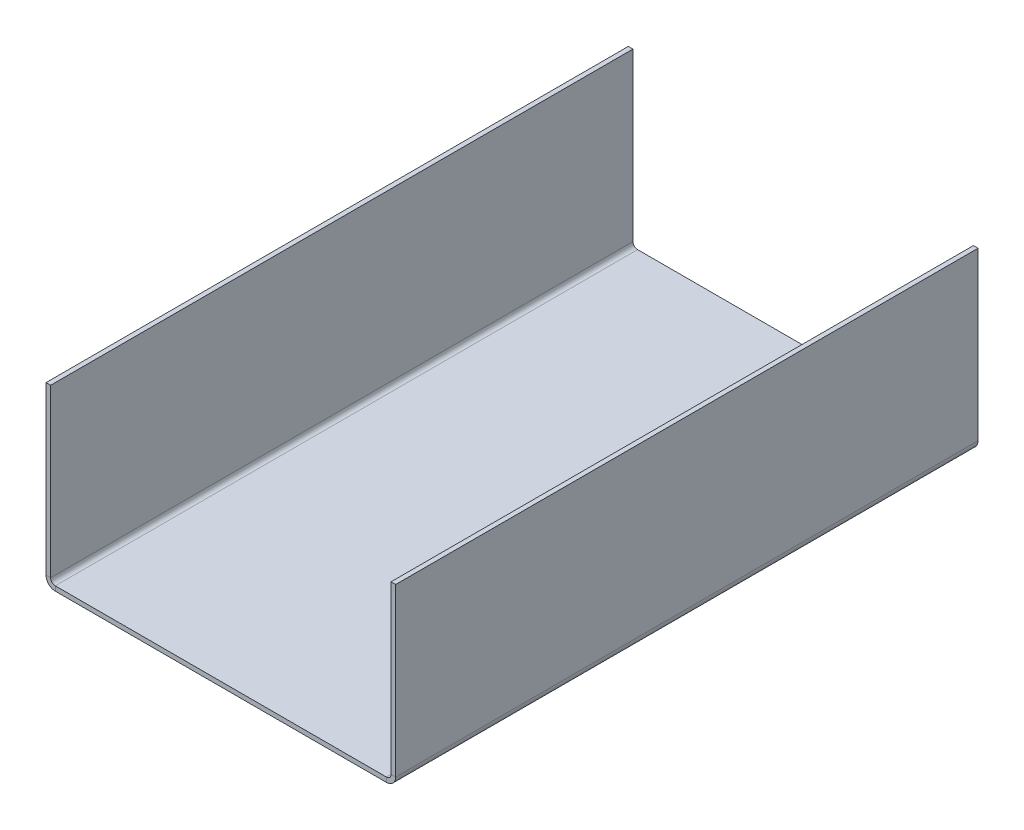
from build123d import *

# Parameters (mm, degrees)
SKETCH_2_W                       = 73.493597356
SKETCH_2_H                       = 125.730953214
SM_BASE_FLANGE_1_DEPTH           = 1
SM_EDGE_FLANGE_1_STRIP_W         = 6
SM_EDGE_FLANGE_1_STRIP_H         = 1
SM_EDGE_FLANGE_1_STRIP_CUT_DEPTH = 125.730953215
SM_EDGE_FLANGE_1_DEPTH           = 125.730953215


# Sheet-metal steps are written as plain solids
with BuildPart() as part:
    # Sketch 2 → Базовая кромка1 (new body)
    with BuildSketch(Plane(origin=(0, 0, 0), x_dir=(1, 0, 0), z_dir=(0, 1, 0))):
        Rectangle(SKETCH_2_W, SKETCH_2_H)
    extrude(amount=-SM_BASE_FLANGE_1_DEPTH)

    # Ребро-кромка1 strip (across the edge) → Ребро-кромка1 strip cut (cut)
    with BuildSketch(Plane(origin=(36.746798678, 0, 62.865476607), x_dir=(-1, 0, 0), z_dir=(0, 0, -1))):
        with Locations((-2, -0.5)):
            Rectangle(SM_EDGE_FLANGE_1_STRIP_W, SM_EDGE_FLANGE_1_STRIP_H)
    sm_edge_flange_1_strip_cut = extrude(amount=SM_EDGE_FLANGE_1_STRIP_CUT_DEPTH, mode=Mode.SUBTRACT)

    # Ребро-кромка1 section (across the edge) → Ребро-кромка1 (add)
    with BuildSketch(Plane(origin=(36.746798678, 0, 62.865476607), x_dir=(-1, 0, 0), z_dir=(0, 0, -1))):
        with BuildLine():
            Line((-1, 1), (-1, 37))
            Line((-1, 37), (0, 37))
            Line((0, 37), (0, 1))
            ThreePointArc((0, 1), (0.292893219, 0.292893219), (1, 0))
            Line((1, 0), (1, -1))
            ThreePointArc((1, -1), (-0.414213562, -0.414213562), (-1, 1))
        make_face()
    sm_edge_flange_1 = extrude(amount=SM_EDGE_FLANGE_1_DEPTH)

    # Зеркальное отражение1: Ребро-кромка1 strip cut, Ребро-кромка1 across plane
    add(sm_edge_flange_1_strip_cut.mirror(Plane(origin=(0, 0, 0), x_dir=(0, 0, 1), z_dir=(1, 0, 0))), mode=Mode.SUBTRACT)
    add(sm_edge_flange_1.mirror(Plane(origin=(0, 0, 0), x_dir=(0, 0, 1), z_dir=(1, 0, 0))))


solid = part.part
